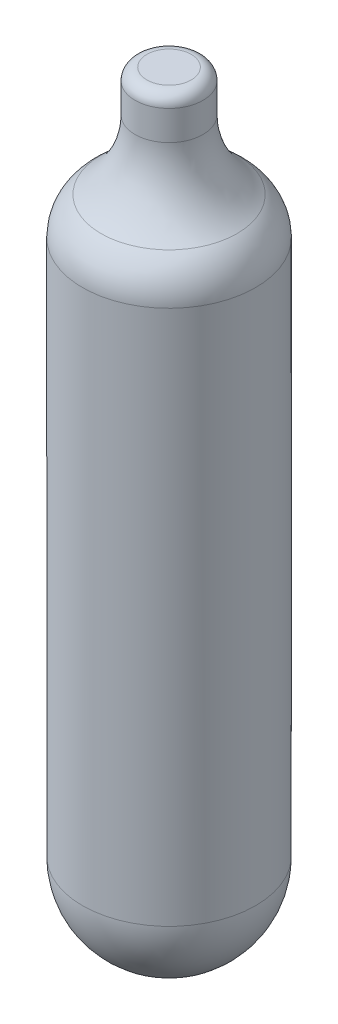
from build123d import *

# Parameters (mm, degrees)
SKETCH2_R           = 9.3218
BOSS_EXTRUDE1_DEPTH = 82.8802
FILLET1_R           = 9.3218
CUT_EXTRUDE1_START  = -13.0302
SKETCH3_R           = 9.3218
SKETCH3_R_2         = 3.6576
CUT_EXTRUDE1_DEPTH  = 13.0302
FILLET2_R           = 9.3218
FILLET3_R           = 5.08
FILLET5_R           = 1.27


with BuildPart() as part:
    # Sketch2 → Boss-Extrude1 (new body)
    with BuildSketch(Plane(origin=(0, 0, 0), x_dir=(1, 0, 0), z_dir=(0, 1, 0))):
        with Locations(Location((0, 0, 0), (0, 0, 270))):
            Circle(SKETCH2_R)
    extrude(amount=BOSS_EXTRUDE1_DEPTH)

    # Fillet1
    fillet1_edges = [part.edges().sort_by_distance(p)[0] for p in [
        (0, 0, -9.3218),
    ]]
    fillet(fillet1_edges, radius=FILLET1_R)

    # Sketch3 → Cut-Extrude1 (cut)
    with BuildSketch(Plane(origin=(0, 82.8802, 0), x_dir=(1, 0, 0), z_dir=(0, 1, 0)).offset(CUT_EXTRUDE1_START)):
        with Locations(Location((0, 0, 0), (0, 0, 90))):
            Circle(SKETCH3_R)
        with Locations(Location((0, 0, 0), (0, 0, 270))):
            Circle(SKETCH3_R_2, mode=Mode.SUBTRACT)
    extrude(amount=CUT_EXTRUDE1_DEPTH, mode=Mode.SUBTRACT)

    # Fillet2
    # the kernel refuses this fillet: 9.3218 mm, written as the material it adds along each edge
    with BuildSketch(Plane(origin=(0, 69.85, 0), x_dir=(0, 0, 1), z_dir=(-1, 0, 0))) as fillet2_piece_1:
        with BuildLine():
            CenterArc((12.9794, 8.574259005), FILLET2_R, 180, 66.897916031)
            Line((3.6576, 8.574259005), (3.471164, 8.574259005))
            Line((3.471164, 8.574259005), (3.471164, 0))
            Line((3.471164, 0), (3.6576, -0.186436))
            ThreePointArc((3.6576, -0.186436), (6.4897, -0.186436), (9.248648, -0.17148518))
            Line((9.248648, -0.17148518), (9.3218, 0))
        make_face()
    revolve(axis=Axis((0, 69.85, 0), (0, 1, 0)))

    # Fillet3
    fillet3_edges = [part.edges().sort_by_distance(p)[0] for p in [
        (0, 69.85, -9.3218),
    ]]
    fillet(fillet3_edges, radius=FILLET3_R)

    # Fillet5
    fillet5_edges = [part.edges().sort_by_distance(p)[0] for p in [
        (0, 82.8802, -3.6576),
    ]]
    fillet(fillet5_edges, radius=FILLET5_R)


solid = part.part
